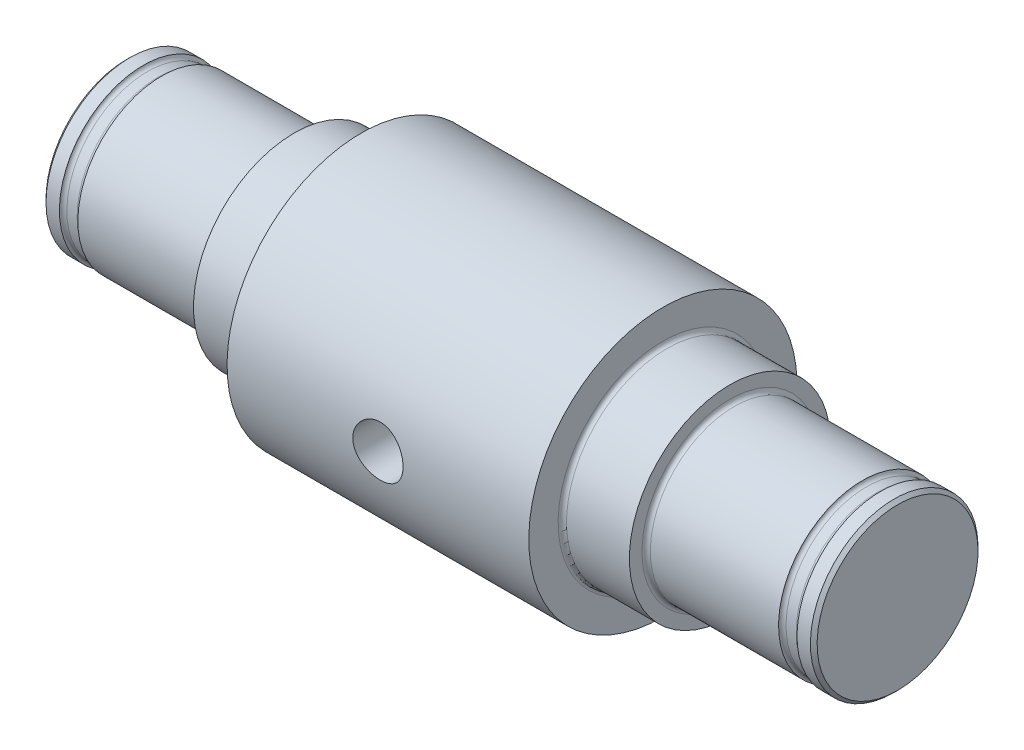
from build123d import *

# Parameters (mm, degrees)
SKETCH2_R          = 1.5
CUT_EXTRUDE1_DEPTH = 30.137604569
FILLET2_R          = 0.25
FILLET3_R          = 0.25
CHAMFER1_SIZE      = 0.2


with BuildPart() as part:
    # Sketch1 → Revolve1 (revolve)
    with BuildSketch(Plane.XY, mode=Mode.PRIVATE) as revolve1_sk:
        Polygon((-23, 0), (-23, 5), (-22, 5), (-22, 4.8), (-20.9, 4.8), (-20.9, 5), (-13, 5), (-13, 6), (-9, 6), (-9, 8), (9, 8), (9, 6), (13, 6), (13, 5), (20.9, 5), (20.9, 4.8), (22, 4.8), (22, 5), (23, 5), (23, 0), align=None)
    revolve(revolve1_sk.sketch.rotate(Axis((-55.325724278, 0, 0), (1, 0, 0)), 180), axis=Axis((-55.325724278, 0, 0), (1, 0, 0)))

    # Sketch2 → Cut-Extrude1 (cut, through all)
    with BuildSketch(Plane.XY.offset(8)):
        Circle(SKETCH2_R)
    extrude(amount=-CUT_EXTRUDE1_DEPTH, mode=Mode.SUBTRACT)

    # Fillet2
    # the kernel refuses this fillet: 0.25 mm, written as the material it adds along each edge
    with BuildSketch(Plane(origin=(-22, 0, 0), x_dir=(0, -1, 0), z_dir=(0, 0, 1))) as fillet2_piece_1:
        with BuildLine():
            CenterArc((5.05, 0.244948974), FILLET2_R, 180, 78.463040967)
            Line((4.8, 0.244948974), (4.795, 0.244948974))
            Line((4.795, 0.244948974), (4.795, 0))
            Line((4.795, 0), (4.8, -0.005))
            ThreePointArc((4.8, -0.005), (4.9, -0.005), (4.999, -0.004898979))
            Line((4.999, -0.004898979), (5, 0))
        make_face()
    revolve(axis=Axis((-22, 0, 0), (1, 0, 0)))
    with BuildSketch(Plane(origin=(-20.9, 0, 0), x_dir=(0, -1, 0), z_dir=(0, 0, 1))) as fillet2_piece_2:
        with BuildLine():
            CenterArc((5.05, -0.244948974), FILLET2_R, 101.536959033, 78.463040967)
            Line((5, 0), (4.999, 0.004898979))
            ThreePointArc((4.999, 0.004898979), (4.9, 0.005), (4.8, 0.005))
            Line((4.8, 0.005), (4.795, 0))
            Line((4.795, 0), (4.795, -0.244948974))
            Line((4.795, -0.244948974), (4.8, -0.244948974))
        make_face()
    revolve(axis=Axis((-20.9, 0, 0), (1, 0, 0)))
    with BuildSketch(Plane(origin=(20.9, 0, 0), x_dir=(0, -1, 0), z_dir=(0, 0, 1))) as fillet2_piece_3:
        with BuildLine():
            CenterArc((5.05, 0.244948974), FILLET2_R, 180, 78.463040967)
            Line((4.8, 0.244948974), (4.795, 0.244948974))
            Line((4.795, 0.244948974), (4.795, 0))
            Line((4.795, 0), (4.8, -0.005))
            ThreePointArc((4.8, -0.005), (4.9, -0.005), (4.999, -0.004898979))
            Line((4.999, -0.004898979), (5, 0))
        make_face()
    revolve(axis=Axis((20.9, 0, 0), (1, 0, 0)))
    with BuildSketch(Plane(origin=(22, 0, 0), x_dir=(0, -1, 0), z_dir=(0, 0, 1))) as fillet2_piece_4:
        with BuildLine():
            CenterArc((5.05, -0.244948974), FILLET2_R, 101.536959033, 78.463040967)
            Line((5, 0), (4.999, 0.004898979))
            ThreePointArc((4.999, 0.004898979), (4.9, 0.005), (4.8, 0.005))
            Line((4.8, 0.005), (4.795, 0))
            Line((4.795, 0), (4.795, -0.244948974))
            Line((4.795, -0.244948974), (4.8, -0.244948974))
        make_face()
    revolve(axis=Axis((22, 0, 0), (1, 0, 0)))

    # Fillet3
    fillet3_edges = [part.edges().sort_by_distance(p)[0] for p in [
        (-13, 5, 0),
        (-9, 6, 0),
        (9, 6, 0),
        (13, 5, 0),
    ]]
    fillet(fillet3_edges, radius=FILLET3_R)

    # Chamfer1
    chamfer1_edges = [part.edges().sort_by_distance(p)[0] for p in [
        (23, 5, 0),
        (-23, 5, 0),
    ]]
    chamfer(chamfer1_edges, length=CHAMFER1_SIZE)


solid = part.part
